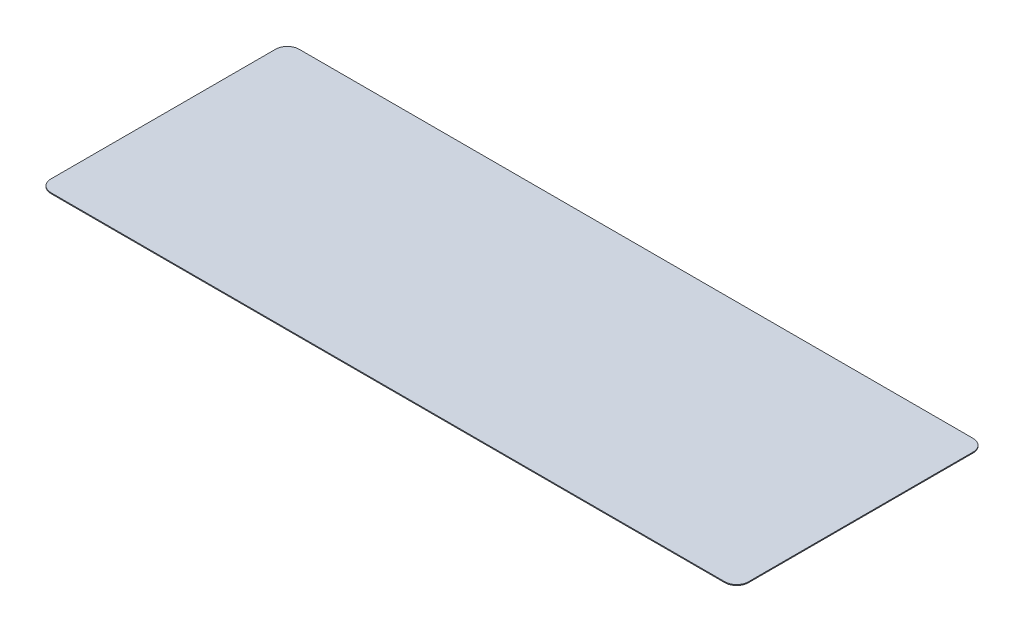
from build123d import *

# Parameters (mm, degrees)
SKETCH1_W           = 590
SKETCH1_H           = 210
BOSS_EXTRUDE1_DEPTH = 0.76
FILLET1_R           = 10


with BuildPart() as part:
    # Sketch1 → Boss-Extrude1 (new body)
    with BuildSketch(Plane(origin=(0, 0, 0), x_dir=(1, 0, 0), z_dir=(0, 1, 0))):
        Rectangle(SKETCH1_W, SKETCH1_H)
    extrude(amount=BOSS_EXTRUDE1_DEPTH)

    # Fillet1
    fillet1_edges = [part.edges().sort_by_distance(p)[0] for p in [
        (-295, 0.38, 105),
        (295, 0.38, 105),
        (295, 0.38, -105),
        (-295, 0.38, -105),
    ]]
    fillet(fillet1_edges, radius=FILLET1_R)


solid = part.part
